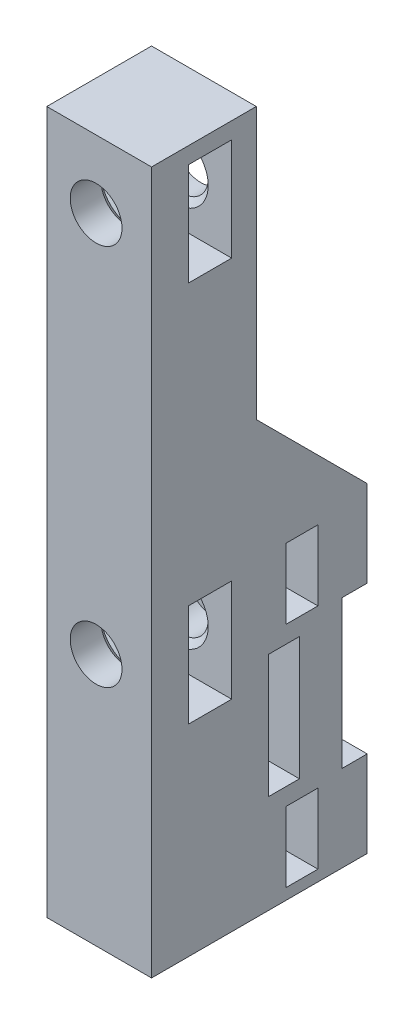
from build123d import *

# Parameters (mm, degrees)
ESQUISSE1_W              = 8.5
ESQUISSE1_H              = 72
ESQUISSE1_R              = 2.1
BOSS_EXTRU_1_DEPTH       = 17.5
ENL_V_START              = -3
ENL_V_MAT_EXTRU_4_DEPTH  = 3.5
ESQUISSE7_R              = 2.1
BOSS_EXTRU_3_DEPTH       = 8
ESQUISSE3_W              = 8.5
ESQUISSE3_H              = 4
ENL_V_MAT_EXTRU_3_DEPTH  = 19
BOSS_EXTRU_2_START       = -7
BOSS_EXTRU_2_DEPTH       = 12
ESQUISSE8_W              = 8.5
ESQUISSE8_H              = 7
BOSS_EXTRU_4_DEPTH       = 4
ESQUISSE9_R              = 1.6
ENL_V_MAT_EXTRU_5_DEPTH  = 5
ENL_V_START_2            = -4
ESQUISSE10_R             = 1.6
ENL_V_MAT_EXTRU_6_DEPTH  = 2.6
ESQUISSE11_R             = 1.6
ENL_V_MAT_EXTRU_7_DEPTH  = 1.6
ESQUISSE14_W             = 2.5
ESQUISSE14_H             = 10
ENL_V_MAT_EXTRU_9_DEPTH  = 17.6
CHANFREIN1_SIZE          = 0.5
ESQUISSE15_W             = 2.6
ESQUISSE15_H             = 5.7
ESQUISSE15_W_2           = 2.5
ESQUISSE15_H_2           = 10
ESQUISSE15_W_3           = 8.5
ESQUISSE15_H_3           = 15
ENL_V_MAT_EXTRU_10_DEPTH = 10
CHANFREIN2_SIZE          = 9


with BuildPart() as part:
    # Esquisse1 → Boss.-Extru.1 (new body)
    with BuildSketch(Plane.XY):
        with Locations((4.25, 36)):
            Rectangle(ESQUISSE1_W, ESQUISSE1_H)
        with Locations((4, 20.5)):
            Circle(ESQUISSE1_R, mode=Mode.SUBTRACT)
        with Locations((4, 51.5)):
            Circle(ESQUISSE1_R, mode=Mode.SUBTRACT)
    extrude(amount=BOSS_EXTRU_1_DEPTH)

    # Esquisse6 → Enlèv. mat.-Extru.4 (cut)
    with BuildSketch(Plane.XY.offset(17.5).offset(ENL_V_START)):
        Polygon((7.6, 22.578460969), (4, 24.656921938), (0.4, 22.578460969), (0.4, 18.421539031), (4, 16.343078062), (7.6, 18.421539031), align=None)
        Polygon((8.5, 24.656921938), (4, 24.656921938), (7.6, 22.578460969), (7.6, 18.421539031), (4, 16.343078062), (8.5, 16.343078062), align=None)
    enl_v_mat_extru_4 = extrude(amount=-ENL_V_MAT_EXTRU_4_DEPTH, mode=Mode.SUBTRACT)

    # Esquisse7 → Boss.-Extru.3 (add)
    with BuildSketch(Plane(origin=(0, 0, 0), x_dir=(-1, 0, 0), z_dir=(0, 0, -1))):
        with Locations((-4, 20.5)):
            Circle(ESQUISSE7_R)
    boss_extru_3 = extrude(amount=-BOSS_EXTRU_3_DEPTH)

    # Esquisse3 → Enlèv. mat.-Extru.3 (cut)
    with BuildSketch(Plane(origin=(0, 0, 0), x_dir=(-1, 0, 0), z_dir=(0, -1, 0))):
        with Locations((-4.25, -2)):
            Rectangle(ESQUISSE3_W, ESQUISSE3_H)
    enl_v_mat_extru_3 = extrude(amount=-ENL_V_MAT_EXTRU_3_DEPTH, mode=Mode.SUBTRACT)

    # Esquisse5 → Boss.-Extru.2 (add)
    with BuildSketch(Plane.XZ.offset(BOSS_EXTRU_2_START)):
        with BuildLine():
            ThreePointArc((4.662966643, 2.165487935), (4.682946936, 2.27184931), (4.714353535, 2.375413685))
            ThreePointArc((4.714353535, 2.375413685), (5.229781903, 2.78475984), (5.773646598, 2.414028307))
            ThreePointArc((5.773646598, 2.414028307), (5.814751932, 2.291920009), (5.839789089, 2.165534781))
            ThreePointArc((5.839789089, 2.165534781), (5.889607538, 2.072347427), (5.988503907, 2.035128225))
            Line((5.988503907, 2.035128225), (6.514258005, 2.035128225))
            ThreePointArc((6.514258005, 2.035128225), (6.613136609, 2.072331852), (6.662966643, 2.165487935))
            ThreePointArc((6.662966643, 2.165487935), (6.682946936, 2.27184931), (6.714353535, 2.375413685))
            ThreePointArc((6.714353535, 2.375413685), (7.229781903, 2.78475984), (7.773646598, 2.414028307))
            ThreePointArc((7.773646598, 2.414028307), (7.814751932, 2.291920009), (7.839789089, 2.165534781))
            ThreePointArc((7.839789089, 2.165534781), (7.889607538, 2.072347427), (7.988503907, 2.035128225))
            Line((7.988503907, 2.035128225), (8.5, 2.035128225))
            Line((8.5, 2.035128225), (8.5, 4))
            Line((8.5, 4), (0, 4))
            Line((0, 4), (0, 2.035128225))
            Line((0, 2.035128225), (0.514258005, 2.035128225))
            ThreePointArc((0.514258005, 2.035128225), (0.61313661, 2.072331853), (0.662966644, 2.165487937))
            ThreePointArc((0.662966644, 2.165487937), (0.682946936, 2.271849312), (0.714353535, 2.375413685))
            ThreePointArc((0.714353535, 2.375413685), (1.229781903, 2.78475984), (1.773646598, 2.414028307))
            ThreePointArc((1.773646598, 2.414028307), (1.814751932, 2.291920009), (1.839789089, 2.165534781))
            ThreePointArc((1.839789089, 2.165534781), (1.889607538, 2.072347427), (1.988503907, 2.035128225))
            Line((1.988503907, 2.035128225), (2.514258006, 2.035128225))
            ThreePointArc((2.514258006, 2.035128225), (2.613136611, 2.072331854), (2.662966644, 2.16548794))
            ThreePointArc((2.662966644, 2.16548794), (2.682946936, 2.271849313), (2.714353535, 2.375413685))
            ThreePointArc((2.714353535, 2.375413685), (3.229781903, 2.78475984), (3.773646598, 2.414028307))
            ThreePointArc((3.773646598, 2.414028307), (3.814751932, 2.291920009), (3.839789089, 2.165534781))
            ThreePointArc((3.839789089, 2.165534781), (3.889607538, 2.072347427), (3.988503907, 2.035128225))
            Line((3.988503907, 2.035128225), (4.514258005, 2.035128225))
            ThreePointArc((4.514258005, 2.035128225), (4.613136609, 2.072331852), (4.662966643, 2.165487935))
        make_face()
    boss_extru_2 = extrude(amount=-BOSS_EXTRU_2_DEPTH)

    # Esquisse8 → Boss.-Extru.4 (add)
    with BuildSketch(Plane(origin=(0, 0, 4), x_dir=(-1, 0, 0), z_dir=(0, 0, -1))):
        with Locations((-4.25, 3.5)):
            Rectangle(ESQUISSE8_W, ESQUISSE8_H)
    boss_extru_4 = extrude(amount=BOSS_EXTRU_4_DEPTH)

    # Esquisse9 → Enlèv. mat.-Extru.5 (cut)
    with BuildSketch(Plane(origin=(0, 0, 0), x_dir=(-1, 0, 0), z_dir=(0, 0, -1))):
        with Locations((-4.25, 3.75)):
            Circle(ESQUISSE9_R)
        with Locations((-4.25, 22.25)):
            Circle(ESQUISSE9_R)
    enl_v_mat_extru_5 = extrude(amount=-ENL_V_MAT_EXTRU_5_DEPTH, mode=Mode.SUBTRACT)

    # Esquisse10 → Enlèv. mat.-Extru.6 (cut)
    # profile 1 of 4: a face of its own
    with BuildSketch(Plane(origin=(0, 0, 0), x_dir=(-1, 0, 0), z_dir=(0, 0, -1)).offset(ENL_V_START_2)):
        Polygon((-2.604551733, 25.1), (-5.895448267, 25.1), (-7.540896534, 22.25), (-5.895448267, 19.4), (-2.604551733, 19.4), (-0.959103466, 22.25), align=None)
        with Locations((-4.25, 22.25)):
            Circle(ESQUISSE10_R, mode=Mode.SUBTRACT)
    # profile 2 of 4: a face of its own
    with BuildSketch(Plane(origin=(0, 0, 0), x_dir=(-1, 0, 0), z_dir=(0, 0, -1)).offset(ENL_V_START_2)):
        Polygon((-2.604551733, 6.6), (-5.895448267, 6.6), (-7.540896534, 3.75), (-5.895448267, 0.9), (-2.604551733, 0.9), (-0.959103466, 3.75), align=None)
    # profile 3 of 4: a face of its own
    with BuildSketch(Plane(origin=(0, 0, 0), x_dir=(-1, 0, 0), z_dir=(0, 0, -1)).offset(ENL_V_START_2)):
        Polygon((-8.5, 6.6), (-5.895448267, 6.6), (-7.540896534, 3.75), (-5.895448267, 0.9), (-8.5, 0.9), align=None)
    # profile 4 of 4: a face of its own
    with BuildSketch(Plane(origin=(0, 0, 0), x_dir=(-1, 0, 0), z_dir=(0, 0, -1)).offset(ENL_V_START_2)):
        Polygon((-7.540896534, 22.25), (-5.895448267, 25.1), (-8.5, 25.1), (-8.5, 19.4), (-5.895448267, 19.4), align=None)
    enl_v_mat_extru_6 = extrude(amount=-ENL_V_MAT_EXTRU_6_DEPTH, mode=Mode.SUBTRACT)

    # Esquisse11 → Enlèv. mat.-Extru.7 (cut)
    with BuildSketch(Plane(origin=(0, 0, 5), x_dir=(-1, 0, 0), z_dir=(0, 0, -1))):
        with Locations((-4.25, 22.25)):
            Circle(ESQUISSE11_R)
    enl_v_mat_extru_7 = extrude(amount=-ENL_V_MAT_EXTRU_7_DEPTH, mode=Mode.SUBTRACT)

    # Esquisse14 → Enlèv. mat.-Extru.9 (cut)
    with BuildSketch(Plane(origin=(8.5, 0, 0), x_dir=(0, 0, -1), z_dir=(1, 0, 0))):
        with Locations((-6.75, 13)):
            Rectangle(ESQUISSE14_W, ESQUISSE14_H)
    enl_v_mat_extru_9 = extrude(amount=-ENL_V_MAT_EXTRU_9_DEPTH, mode=Mode.SUBTRACT)

    # Symétrie14: Enlèv. mat.-Extru.4, Boss.-Extru.3, Enlèv. mat.-Extru.3, Boss.-Extru.2, Boss.-Extru.4, Enlèv. mat.-Extru.5, Enlèv. mat.-Extru.6, Enlèv. mat.-Extru.7, Enlèv. mat.-Extru.9 across plane
    add(enl_v_mat_extru_4.mirror(Plane(origin=(0, 36, 0), x_dir=(0, 0, 1), z_dir=(0, -1, 0))), mode=Mode.SUBTRACT)
    add(boss_extru_3.mirror(Plane(origin=(0, 36, 0), x_dir=(0, 0, 1), z_dir=(0, -1, 0))))
    add(enl_v_mat_extru_3.mirror(Plane(origin=(0, 36, 0), x_dir=(0, 0, 1), z_dir=(0, -1, 0))), mode=Mode.SUBTRACT)
    add(boss_extru_2.mirror(Plane(origin=(0, 36, 0), x_dir=(0, 0, 1), z_dir=(0, -1, 0))))
    add(boss_extru_4.mirror(Plane(origin=(0, 36, 0), x_dir=(0, 0, 1), z_dir=(0, -1, 0))))
    add(enl_v_mat_extru_5.mirror(Plane(origin=(0, 36, 0), x_dir=(0, 0, 1), z_dir=(0, -1, 0))), mode=Mode.SUBTRACT)
    add(enl_v_mat_extru_6.mirror(Plane(origin=(0, 36, 0), x_dir=(0, 0, 1), z_dir=(0, -1, 0))), mode=Mode.SUBTRACT)
    add(enl_v_mat_extru_7.mirror(Plane(origin=(0, 36, 0), x_dir=(0, 0, 1), z_dir=(0, -1, 0))), mode=Mode.SUBTRACT)
    add(enl_v_mat_extru_9.mirror(Plane(origin=(0, 36, 0), x_dir=(0, 0, 1), z_dir=(0, -1, 0))), mode=Mode.SUBTRACT)

    # Chanfrein1
    chanfrein1_edges = [part.edges().sort_by_distance(p)[0] for p in [
        (1.9, 51.5, 14.5),
        (1.9, 51.5, 11),
        (1.9, 20.5, 11),
        (1.9, 20.5, 14.5),
    ]]
    chamfer(chanfrein1_edges, length=CHANFREIN1_SIZE)

    # Esquisse15 → Enlèv. mat.-Extru.10 (cut)
    # profile 1 of 2: a face of its own
    with BuildSketch(Plane(origin=(8.5, 0, 0), x_dir=(0, 0, -1), z_dir=(1, 0, 0))):
        Polygon((-9, 26), (0, 26), (0, 53), (-2.035128225, 53), (-2.035128225, 65), (0, 65), (0, 72), (-9, 72), (-9, 57), align=None)
        with Locations((-5.3, 49.75)):
            Rectangle(ESQUISSE15_W, ESQUISSE15_H, mode=Mode.SUBTRACT)
        with Locations((-6.75, 59)):
            Rectangle(ESQUISSE15_W_2, ESQUISSE15_H_2, mode=Mode.SUBTRACT)
        with Locations((-5.3, 68.25)):
            Rectangle(ESQUISSE15_W, ESQUISSE15_H, mode=Mode.SUBTRACT)
    # profile 2 of 2: a face of its own
    with BuildSketch(Plane(origin=(8.5, 0, 0), x_dir=(0, 0, -1), z_dir=(1, 0, 0))):
        with Locations((-13.25, 64.5)):
            Rectangle(ESQUISSE15_W_3, ESQUISSE15_H_3)
    extrude(amount=-ENL_V_MAT_EXTRU_10_DEPTH, mode=Mode.SUBTRACT)


with BuildPart() as enl_v_mat_extru_10_kept_piece:
    # of the separate pieces the step leaves, the one the design keeps (enl_v_mat_extru_10_pieces_kept)
    add(part.part.solids().sort_by_distance((6.6, 20.5, 14.5))[0])

    # Chanfrein2
    chanfrein2_edges = [enl_v_mat_extru_10_kept_piece.edges().sort_by_distance(p)[0] for p in [
        (4.25, 26, 9),
    ]]
    chamfer(chanfrein2_edges, length=CHANFREIN2_SIZE - 0.0001)  # a hair under: the kernel refuses the full size


solid = enl_v_mat_extru_10_kept_piece.part
